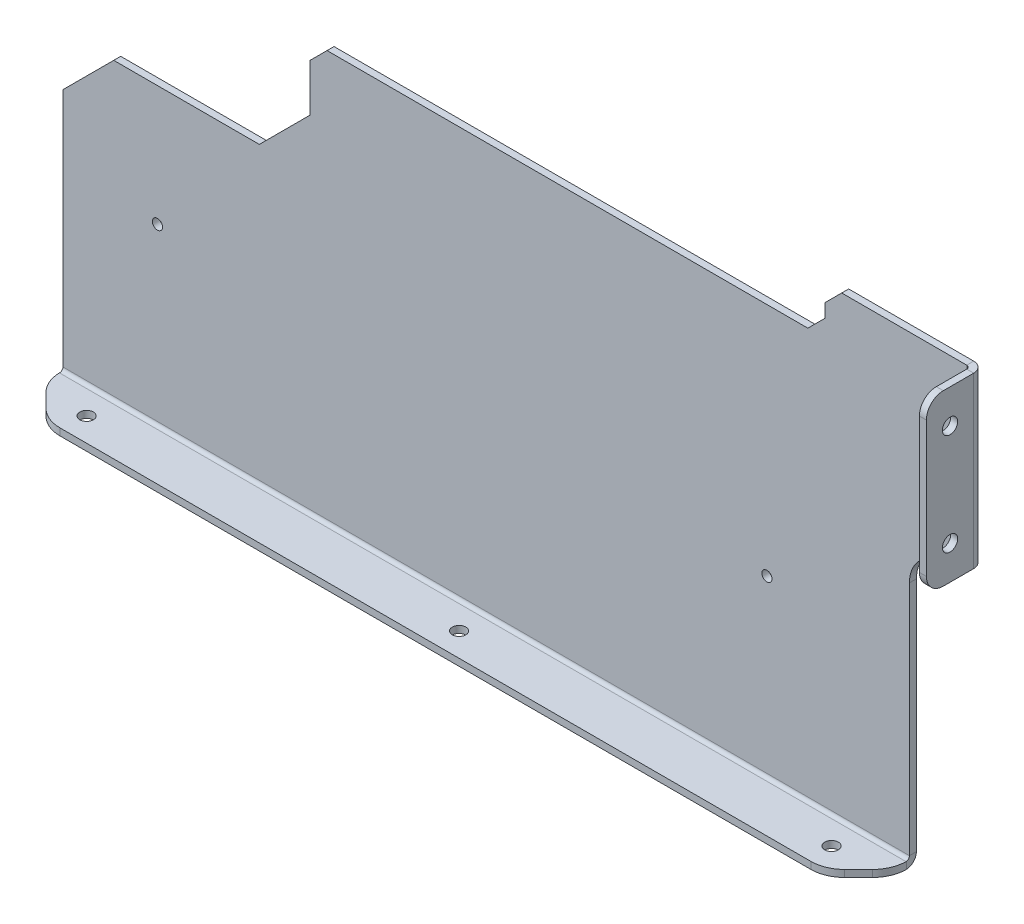
from build123d import *

# Parameters (mm, degrees)
SKETCH1_W                    = 250
SKETCH1_H                    = 153
BASE_FLANGE1_DEPTH           = 2.06
EDGE_FLANGE1_STRIP_W         = 10.272
EDGE_FLANGE1_STRIP_H         = 2.06
EDGE_FLANGE1_STRIP_CUT_DEPTH = 250
EDGE_FLANGE1_DEPTH           = 250
EDGE_FLANGE2_DEPTH           = 50
CHAMFER1_SIZE                = 10
SKETCH13_R                   = 2
CUT_EXTRUDE2_DEPTH           = 8.4
SKETCH14_R                   = 2.25
CUT_EXTRUDE3_DEPTH           = 8.4
SKETCH20_W                   = 73
SKETCH20_H                   = 64
CUT_EXTRUDE9_DEPTH           = 10
FILLET1_R                    = 10
CHAMFER3_SIZE                = 15
CHAMFER4_SIZE                = 15
SKETCH21_R                   = 1.5
CUT_EXTRUDE10_DEPTH          = 10
FILLET2_R                    = 5
CUT_EXTRUDE11_DEPTH          = 10
CHAMFER5_SIZE                = 5


# Sheet-metal steps are written as plain solids
with BuildPart() as part:
    # Sketch1 → Base-Flange1 (new body)
    with BuildSketch(Plane.XY):
        with Locations((125, 76.5)):
            Rectangle(SKETCH1_W, SKETCH1_H)
    extrude(amount=-BASE_FLANGE1_DEPTH)

    # Edge-Flange1 strip (across the edge) → Edge-Flange1 strip cut (cut)
    with BuildSketch(Plane.YZ):
        with Locations((-2.06, -1.03)):
            Rectangle(EDGE_FLANGE1_STRIP_W, EDGE_FLANGE1_STRIP_H)
    extrude(amount=EDGE_FLANGE1_STRIP_CUT_DEPTH, mode=Mode.SUBTRACT)

    # Edge-Flange1 section (across the edge) → Edge-Flange1 (add)
    with BuildSketch(Plane.YZ):
        with BuildLine():
            Line((0, 1.016), (0, 15))
            Line((0, 15), (2.06, 15))
            Line((2.06, 15), (2.06, 1.016))
            ThreePointArc((2.06, 1.016), (2.35757951, 0.29757951), (3.076, 0))
            Line((3.076, 0), (3.076, -2.06))
            ThreePointArc((3.076, -2.06), (0.900939541, -1.159060459), (0, 1.016))
        make_face()
    extrude(amount=EDGE_FLANGE1_DEPTH)

    # Edge-Flange2 section (across the edge) → Edge-Flange2 (add)
    with BuildSketch(Plane(origin=(270, 87, 0), x_dir=(-1, 0, 0), z_dir=(0, 1, 0))):
        with BuildLine():
            Line((0, 1.016), (0, 15))
            Line((0, 15), (2.06, 15))
            Line((2.06, 15), (2.06, 1.016))
            ThreePointArc((2.06, 1.016), (2.35757951, 0.29757951), (3.076, 0))
            Line((3.076, 0), (20, 0))
            Line((20, 0), (20, -2.06))
            Line((20, -2.06), (3.076, -2.06))
            ThreePointArc((3.076, -2.06), (0.900939541, -1.159060459), (0, 1.016))
        make_face()
    extrude(amount=EDGE_FLANGE2_DEPTH)

    # Chamfer1
    chamfer1_edges = [part.edges().sort_by_distance(p)[0] for p in [
        (0, 1.03, 15),
        (250, 1.03, 15),
        (250, 87, -1.03),
        (250, 153, -1.03),
    ]]
    chamfer(chamfer1_edges, length=CHAMFER1_SIZE)

    # Sketch13 → Cut-Extrude2 (cut)
    with BuildSketch(Plane(origin=(0, 2.06, 0), x_dir=(1, 0, 0), z_dir=(0, 1, 0))):
        with Locations(Location((125, -8.008, 0), (0, 0, 270))):
            Circle(SKETCH13_R)
        with Locations(Location((235, -8.008, 0), (0, 0, 270))):
            Circle(SKETCH13_R)
        with Locations(Location((15, -8.008, 0), (0, 0, 270))):
            Circle(SKETCH13_R)
    extrude(amount=-CUT_EXTRUDE2_DEPTH, mode=Mode.SUBTRACT)

    # Sketch14 → Cut-Extrude3 (cut)
    with BuildSketch(Plane.ZY.offset(-267.94)):
        with Locations((8.008, 127)):
            Circle(SKETCH14_R)
        with Locations((8.008, 97)):
            Circle(SKETCH14_R)
    extrude(amount=-CUT_EXTRUDE3_DEPTH, mode=Mode.SUBTRACT)

    # Sketch20 → Cut-Extrude9 (cut)
    with BuildSketch(Plane.XY):
        with Locations((36.5, 121)):
            Rectangle(SKETCH20_W, SKETCH20_H)
    extrude(amount=-CUT_EXTRUDE9_DEPTH, mode=Mode.SUBTRACT)

    # Fillet1
    fillet1_edges = [part.edges().sort_by_distance(p)[0] for p in [
        (250, 1.03, 5),
        (240, 1.03, 15),
        (10, 1.03, 15),
        (0, 1.03, 5),
        (250, 77, -1.03),
        (260, 87, -1.03),
    ]]
    fillet(fillet1_edges, radius=FILLET1_R)

    # Chamfer3
    chamfer3_edges = [part.edges().sort_by_distance(p)[0] for p in [
        (0, 89, -1.03),
    ]]
    chamfer(chamfer3_edges, length=CHAMFER3_SIZE)

    # Chamfer4
    chamfer4_edges = [part.edges().sort_by_distance(p)[0] for p in [
        (73, 89, -1.03),
    ]]
    chamfer(chamfer4_edges, length=CHAMFER4_SIZE)

    # Sketch21 → Cut-Extrude10 (cut)
    with BuildSketch(Plane.XY):
        with Locations((27.91, 53.53)):
            Circle(SKETCH21_R)
        with Locations((207.91, 53.53)):
            Circle(SKETCH21_R)
    extrude(amount=-CUT_EXTRUDE10_DEPTH, mode=Mode.SUBTRACT)

    # Fillet2
    fillet2_edges = [part.edges().sort_by_distance(p)[0] for p in [
        (268.97, 87, 15),
        (268.97, 137, 15),
    ]]
    fillet(fillet2_edges, radius=FILLET2_R)

    # Sketch22 → Cut-Extrude11 (cut)
    with BuildSketch(Plane.XY):
        Polygon((250, 137), (250, 143), (240, 153), (73, 153), (73, 123), (225, 123), (225, 137), align=None)
    extrude(amount=-CUT_EXTRUDE11_DEPTH, mode=Mode.SUBTRACT)

    # Chamfer5
    chamfer5_edges = [part.edges().sort_by_distance(p)[0] for p in [
        (225, 137, -1.03),
        (225, 123, -1.03),
        (73, 123, -1.03),
    ]]
    chamfer(chamfer5_edges, length=CHAMFER5_SIZE)


solid = part.part
